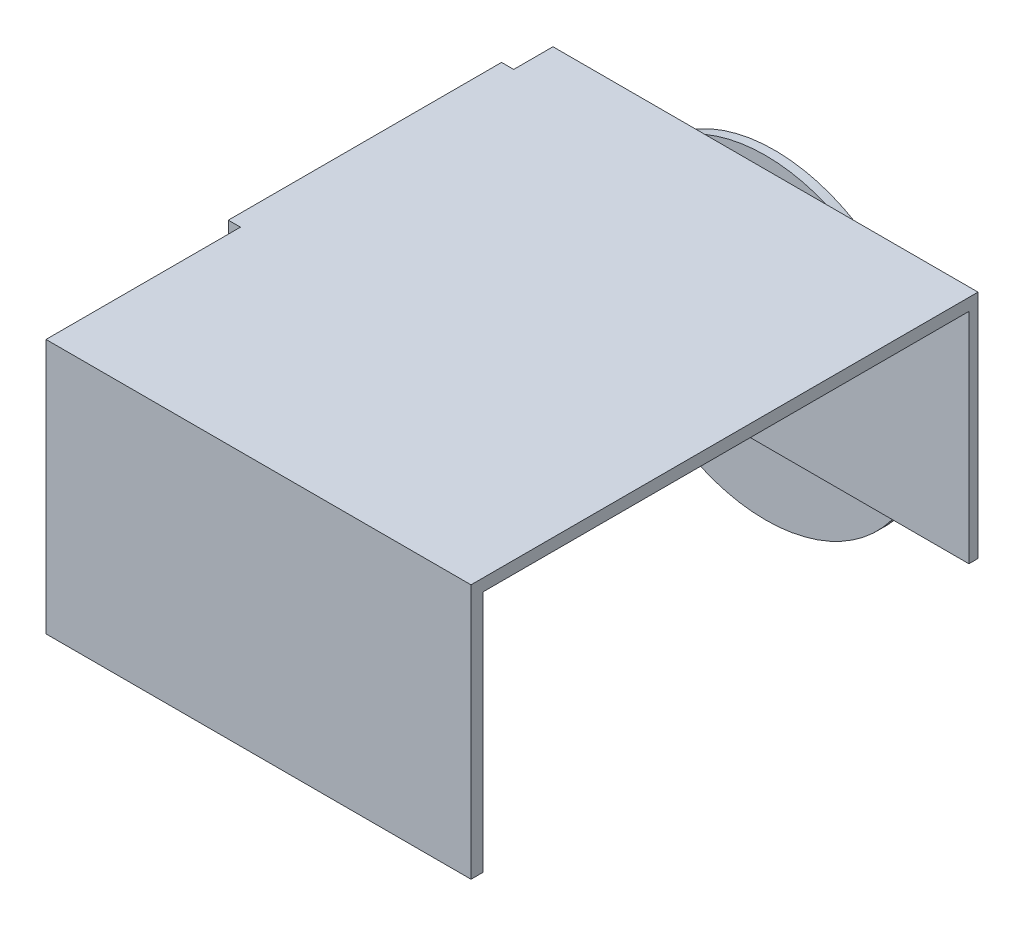
from build123d import *

# Parameters (mm, degrees)
SKETCH_1_R      = 26
EXTRUDE_1_DEPTH = 1.5
EXTRUDE_2_DEPTH = 1.5
SKETCH_3_W      = 70
SKETCH_3_H      = 2
EXTRUDE_3_DEPTH = 82
SKETCH_4_W      = 70
SKETCH_4_H      = 2
EXTRUDE_4_DEPTH = 40
SKETCH_5_R      = 18.5
EXTRUDE_5_DEPTH = 2


with BuildPart() as part:
    # 草图1 → 凸台-拉伸1 (new body)
    with BuildSketch(Plane.XY):
        Circle(SKETCH_1_R)
    extrude(amount=EXTRUDE_1_DEPTH)

    # 草图2 → 凸台-拉伸2 (add)
    with BuildSketch(Plane.XY.offset(1.5)):
        Polygon((-35, 24), (-35, -14), (-21.9089023, -14), (21.9089023, -14), (35, -14), (35, 24), align=None)
    extrude(amount=EXTRUDE_2_DEPTH)

    # 草图3 → 凸台-拉伸3 (add)
    with BuildSketch(Plane.XY.offset(3)):
        with Locations((0, 23)):
            Rectangle(SKETCH_3_W, SKETCH_3_H)
    extrude(amount=EXTRUDE_3_DEPTH)

    # 草图4 → 凸台-拉伸4 (add)
    with BuildSketch(Plane.XZ.offset(-22)):
        with Locations((0, 84)):
            Rectangle(SKETCH_4_W, SKETCH_4_H)
    extrude(amount=EXTRUDE_4_DEPTH)

    # 草图5 → 凸台-拉伸5 (add)
    with BuildSketch(Plane.ZY.offset(35)):
        Polygon((7.970689751, -18), (77.970689751, -18), (77.970689751, -11), (52.970689751, -11), (52.970689751, 22), (52.970689751, 24), (7.970689751, 24), (7.970689751, 22), align=None)
        with Locations((30.470689751, 2)):
            Circle(SKETCH_5_R, mode=Mode.SUBTRACT)
    extrude(amount=EXTRUDE_5_DEPTH)


solid = part.part
